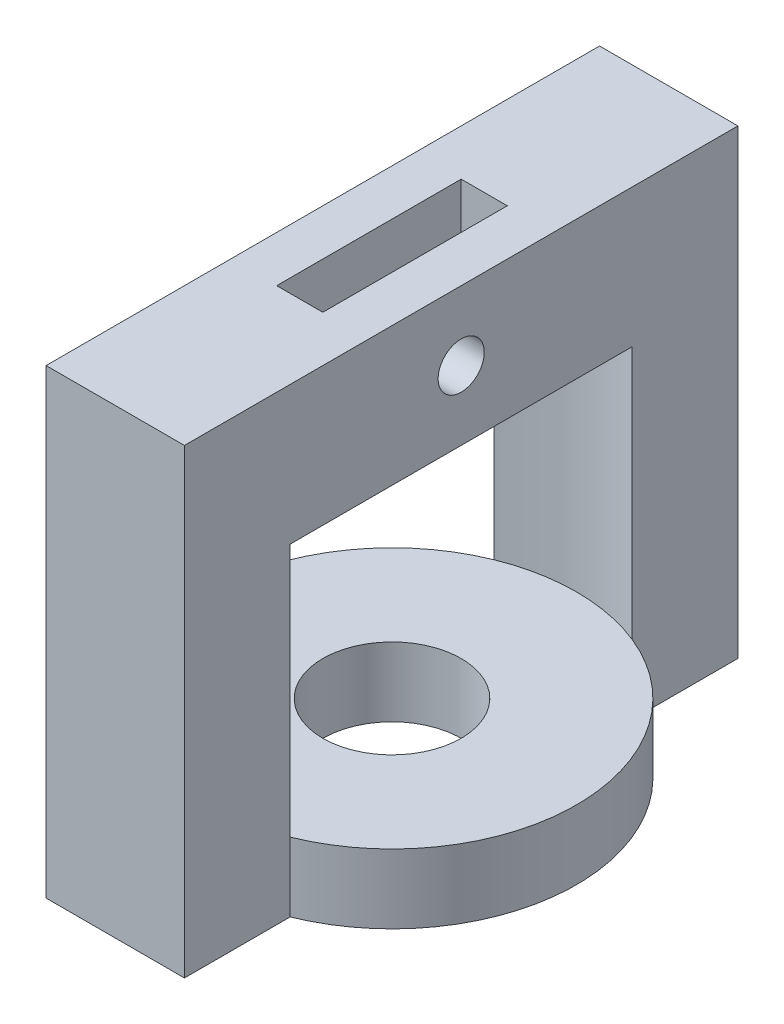
from build123d import *

# Parameters (mm, degrees)
SKETCH1_R           = 4
SKETCH1_R_2         = 1.5
BOSS_EXTRUDE1_DEPTH = 1.5
BOSS_EXTRUDE2_DEPTH = 7
SKETCH4_W           = 3
SKETCH4_H           = 12
BOSS_EXTRUDE3_DEPTH = 3
CUT_EXTRUDE1_REACH  = 14.329
SKETCH5_W           = 1
SKETCH5_H           = 4
SKETCH6_R           = 0.5
CUT_EXTRUDE2_DEPTH  = 13.893796958


with BuildPart() as part:
    # Sketch1 → Boss-Extrude1 (new body)
    with BuildSketch(Plane(origin=(0, 0, 0), x_dir=(1, 0, 0), z_dir=(0, 1, 0))):
        Circle(SKETCH1_R)
        Circle(SKETCH1_R_2, mode=Mode.SUBTRACT)
    extrude(amount=BOSS_EXTRUDE1_DEPTH)

    # Sketch3 → Boss-Extrude2 (add)
    with BuildSketch(Plane(origin=(0, 0, 0), x_dir=(1, 0, 0), z_dir=(0, 1, 0))):
        with BuildLine():
            Line((-1.5, -3.708099244), (-1.5, -6))
            Line((-1.5, -6), (1.5, -6))
            Line((1.5, -6), (1.5, -3.708099244))
            ThreePointArc((1.5, -3.708099244), (0, -4), (-1.5, -3.708099244))
        make_face()
        with BuildLine():
            Line((-1.5, 6), (1.5, 6))
            Line((1.5, 6), (1.5, 3.708099244))
            ThreePointArc((1.5, 3.708099244), (0, 4), (-1.5, 3.708099244))
            Line((-1.5, 3.708099244), (-1.5, 6))
        make_face()
    extrude(amount=BOSS_EXTRUDE2_DEPTH)

    # Sketch4 → Boss-Extrude3 (add)
    with BuildSketch(Plane(origin=(0, 7, 0), x_dir=(1, 0, 0), z_dir=(0, 1, 0))):
        Rectangle(SKETCH4_W, SKETCH4_H)
    extrude(amount=BOSS_EXTRUDE3_DEPTH)

    # Sketch5 → Cut-Extrude1 (cut, up to next)
    with BuildSketch(Plane(origin=(0, 10, 0), x_dir=(1, 0, 0), z_dir=(0, 1, 0)), mode=Mode.PRIVATE) as cut_extrude1_sk1:
        Rectangle(SKETCH5_W, SKETCH5_H)
    cut_extrude1_tool1 = extrude(cut_extrude1_sk1.sketch, amount=-CUT_EXTRUDE1_REACH, mode=Mode.PRIVATE) & part.part
    add(cut_extrude1_tool1.solids().sort_by_distance((0, 10, 0))[0], mode=Mode.SUBTRACT)

    # Sketch6 → Cut-Extrude2 (cut, through all)
    with BuildSketch(Plane.ZY.offset(1.5)):
        with Locations((0, 8.5)):
            Circle(SKETCH6_R)
    extrude(amount=-CUT_EXTRUDE2_DEPTH, mode=Mode.SUBTRACT)


solid = part.part
